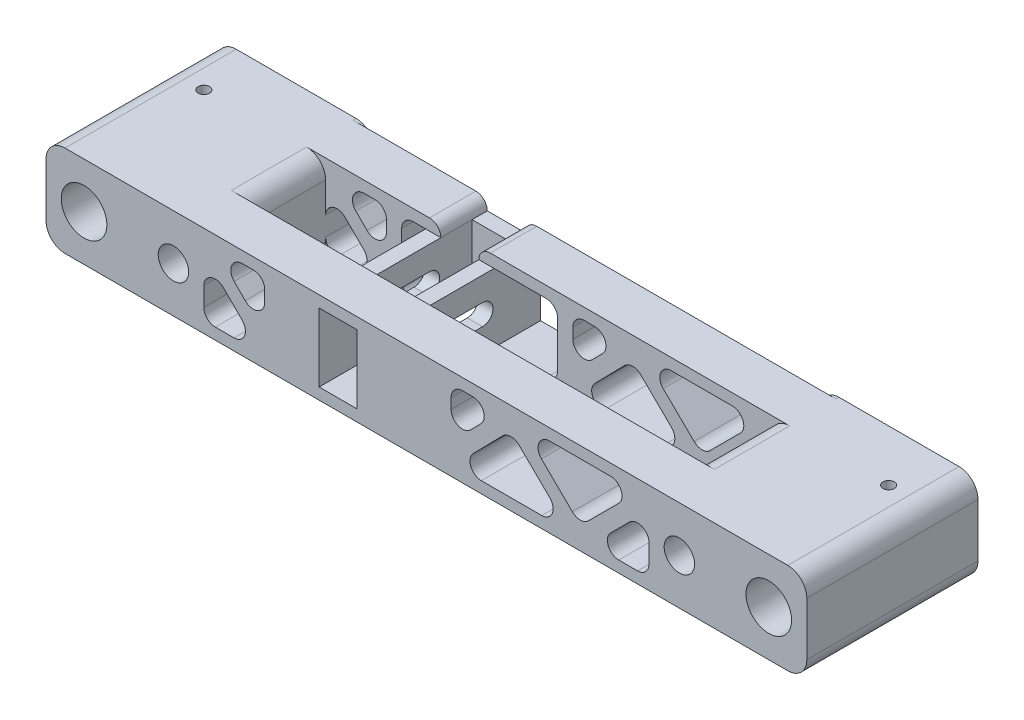
from build123d import *

# Parameters (mm, degrees)
SKETCH1_W           = 100
SKETCH1_H           = 24
SKETCH1_R           = 6
SKETCH1_R_2         = 4
BOSS_EXTRUDE1_DEPTH = 40
SKETCH2_W           = 100
SKETCH2_H           = 24
BOSS_EXTRUDE2_DEPTH = 5
CUT_EXTRUDE1_REACH  = 112.345
SKETCH3_W           = 58.5
SKETCH3_H           = 32.8
SKETCH4_W           = 10
SKETCH4_H           = 18
CUT_EXTRUDE2_DEPTH  = 108.943689023
SKETCH5_W           = 4
SKETCH5_H           = 18
BOSS_EXTRUDE3_DEPTH = 28
SKETCH6_W           = 18
SKETCH6_H           = 18
BOSS_EXTRUDE4_DEPTH = 4
CUT_EXTRUDE3_START  = -18
CUT_EXTRUDE3_DEPTH  = 18
SKETCH8_W           = 76.7
SKETCH8_H           = 12.2
SKETCH8_W_2         = 30.3
BOSS_EXTRUDE5_DEPTH = 3
BOSS_EXTRUDE6_DEPTH = 12.2
FILLET1_R           = 5
FILLET2_R           = 3
CUT_EXTRUDE4_START  = -12.2
CUT_EXTRUDE4_DEPTH  = 12.2
SKETCH11_R          = 1.5
CUT_EXTRUDE5_DEPTH  = 111.344913793
CUT_EXTRUDE6_DEPTH  = 4


with BuildPart() as part:
    # Sketch1 → Boss-Extrude1 (new body)
    with BuildSketch(Plane.XY):
        with Locations((-50, 12)):
            Rectangle(SKETCH1_W, SKETCH1_H)
        with Locations((-90, 12)):
            Circle(SKETCH1_R, mode=Mode.SUBTRACT)
        with Locations((-66.5, 12)):
            Circle(SKETCH1_R_2, mode=Mode.SUBTRACT)
    boss_extrude1 = extrude(amount=BOSS_EXTRUDE1_DEPTH)

    # Sketch2 → Boss-Extrude2 (add)
    with BuildSketch(Plane(origin=(0, 0, 0), x_dir=(-1, 0, 0), z_dir=(0, 0, -1))):
        with Locations((50, 12)):
            Rectangle(SKETCH2_W, SKETCH2_H)
    boss_extrude2 = extrude(amount=BOSS_EXTRUDE2_DEPTH)

    # Sketch3 → Cut-Extrude1 (cut, up to next)
    with BuildSketch(Plane(origin=(0, 24, 0), x_dir=(1, 0, 0), z_dir=(0, 1, 0)), mode=Mode.PRIVATE) as cut_extrude1_sk1:
        with Locations((-29.25, -11.4)):
            Rectangle(SKETCH3_W, SKETCH3_H)
    cut_extrude1_tool1 = extrude(cut_extrude1_sk1.sketch, amount=-CUT_EXTRUDE1_REACH, mode=Mode.PRIVATE) & part.part
    cut_extrude1 = cut_extrude1_tool1.solids().sort_by_distance((-29.25, 24, 11.4))[0]
    add(cut_extrude1, mode=Mode.SUBTRACT)

    # Mirror2: Boss-Extrude1, Boss-Extrude2, Cut-Extrude1 across Right Plane
    add(boss_extrude1.mirror(Plane(origin=(0, 0, 0), x_dir=(0, 0, -1), z_dir=(1, 0, 0))))
    add(boss_extrude2.mirror(Plane(origin=(0, 0, 0), x_dir=(0, 0, -1), z_dir=(1, 0, 0))))
    add(cut_extrude1.mirror(Plane(origin=(0, 0, 0), x_dir=(0, 0, -1), z_dir=(1, 0, 0))), mode=Mode.SUBTRACT)

    # Sketch4 → Cut-Extrude2 (cut, through all)
    with BuildSketch(Plane(origin=(0, 0, 27.8), x_dir=(-1, 0, 0), z_dir=(0, 0, -1))):
        with Locations((23.2, 12)):
            Rectangle(SKETCH4_W, SKETCH4_H)
    extrude(amount=-CUT_EXTRUDE2_DEPTH, mode=Mode.SUBTRACT)

    # Sketch5 → Boss-Extrude3 (add)
    with BuildSketch(Plane(origin=(0, 0, 27.8), x_dir=(-1, 0, 0), z_dir=(0, 0, -1))):
        with Locations((30.2, 12)):
            Rectangle(SKETCH5_W, SKETCH5_H)
        with Locations((16.2, 12)):
            Rectangle(SKETCH5_W, SKETCH5_H)
    extrude(amount=BOSS_EXTRUDE3_DEPTH)

    # Sketch6 → Boss-Extrude4 (add)
    with BuildSketch(Plane(origin=(0, 0, -0.2), x_dir=(-1, 0, 0), z_dir=(0, 0, -1))):
        with Locations((23.2, 12)):
            Rectangle(SKETCH6_W, SKETCH6_H)
    extrude(amount=BOSS_EXTRUDE4_DEPTH)

    # Sketch7 → Cut-Extrude3 (cut)
    with BuildSketch(Plane(origin=(-14.2, 0, 0), x_dir=(0, 0, -1), z_dir=(1, 0, 0)).offset(CUT_EXTRUDE3_START)):
        with BuildLine():
            Line((-20.05, 14.75), (-11.05, 14.75))
            ThreePointArc((-11.05, 14.75), (-8.3, 12), (-11.05, 9.25))
            Line((-11.05, 9.25), (-20.05, 9.25))
            ThreePointArc((-20.05, 9.25), (-22.8, 12), (-20.05, 14.75))
        make_face()
    extrude(amount=CUT_EXTRUDE3_DEPTH, mode=Mode.SUBTRACT)

    # Sketch8 → Boss-Extrude5 (add)
    with BuildSketch(Plane(origin=(0, 21, 0), x_dir=(1, 0, 0), z_dir=(0, 1, 0))):
        with Locations((20.15, -1.9)):
            Rectangle(SKETCH8_W, SKETCH8_H)
        with Locations((-43.35, -1.9)):
            Rectangle(SKETCH8_W_2, SKETCH8_H)
    boss_extrude5 = extrude(amount=BOSS_EXTRUDE5_DEPTH)

    # Mirror4: Boss-Extrude5 across plane
    add(boss_extrude5.mirror(Plane.ZX.offset(12)))

    # Sketch9 → Boss-Extrude6 (add)
    with BuildSketch(Plane(origin=(0, 0, -4.2), x_dir=(-1, 0, 0), z_dir=(0, 0, -1))):
        Polygon((-58.5, 18.171572875), (-43.328427125, 3), (-37.643941895, 3), (-22.177232561, 18.171703978), (-7.294907133, 3), (-2.493324251, 3), (-2.493324251, 21), (-6.493324251, 21), (-6.493324251, 7.894946994), (-19.348417117, 21), (-25.006058105, 21), (-40.486448643, 5.814875767), (-55.671572875, 21), (-58.5, 21), align=None)
        Polygon((55.671572875, 21), (42.5, 7.828427125), (42.5, 21), (38.5, 21), (38.5, 3), (43.328427125, 3), (58.5, 18.171572875), (58.5, 21), align=None)
    extrude(amount=-BOSS_EXTRUDE6_DEPTH)

    # Fillet1
    # the kernel refuses this fillet: 5 mm, written as the material it adds along each edge
    # the kernel refuses this fillet: 5 mm, written as the material it takes off along each edge
    with BuildSketch(Plane(origin=(58.5, 24, -4.5), x_dir=(1, 0, 0), z_dir=(0, 0, 1))) as fillet1_2_piece_1_section:
        with BuildLine():
            CenterArc((FILLET1_R, -FILLET1_R), FILLET1_R, 90, 90)
            Line((0, -FILLET1_R), (0, 0))
            Line((0, 0), (FILLET1_R, 0))
        make_face()
    fillet1_2_piece_1 = extrude(amount=44.8, mode=Mode.PRIVATE)
    fillet1_2_piece_1 = split(fillet1_2_piece_1, bisect_by=Plane(origin=(59.616839695, 22.883160305, -4.2), z_dir=(0, 0, -1)), keep=Keep.TOP, mode=Mode.PRIVATE)
    add(fillet1_2_piece_1, mode=Mode.SUBTRACT)
    with BuildSketch(Plane(origin=(58.5, 24, 8), x_dir=(1, 0, 0), z_dir=(0, 0, 1)), Plane(origin=(-58.5, 0, 8), x_dir=(-1, 0, 0), z_dir=(0, 0, 1))) as fillet1_2_piece_2:
        with BuildLine():
            CenterArc((FILLET1_R, -FILLET1_R), FILLET1_R, 90, 90)
            Line((0, -FILLET1_R), (0, 0))
            Line((0, 0), (FILLET1_R, 0))
        make_face()
    extrude(amount=19.8, mode=Mode.SUBTRACT)
    with BuildSketch(Plane(origin=(-58.5, 24, -4.5), x_dir=(-1, 0, 0), z_dir=(0, 0, 1))) as fillet1_2_piece_3_section:
        with BuildLine():
            CenterArc((FILLET1_R, FILLET1_R), FILLET1_R, 180, 90)
            Line((0, FILLET1_R), (0, 0))
            Line((0, 0), (FILLET1_R, 0))
        make_face()
    fillet1_2_piece_3 = extrude(amount=44.8, mode=Mode.PRIVATE)
    fillet1_2_piece_3 = split(fillet1_2_piece_3, bisect_by=Plane(origin=(-59.616839695, 22.883160305, -4.2), z_dir=(0, 0, -1)), keep=Keep.TOP, mode=Mode.PRIVATE)
    add(fillet1_2_piece_3, mode=Mode.SUBTRACT)
    with BuildSketch(Plane(origin=(-58.5, 24, 8), x_dir=(-1, 0, 0), z_dir=(0, 0, 1)), Plane(origin=(58.5, 0, 8), x_dir=(1, 0, 0), z_dir=(0, 0, 1))) as fillet1_2_piece_4:
        with BuildLine():
            CenterArc((FILLET1_R, FILLET1_R), FILLET1_R, 180, 90)
            Line((0, FILLET1_R), (0, 0))
            Line((0, 0), (FILLET1_R, 0))
        make_face()
    extrude(amount=19.8, mode=Mode.SUBTRACT)
    with BuildSketch(Plane(origin=(58.5, 0, -17.5), x_dir=(1, 0, 0), z_dir=(0, 0, 1)), Plane(origin=(-58.5, 24, -17.5), x_dir=(-1, 0, 0), z_dir=(0, 0, 1))) as fillet1_2_piece_5:
        with BuildLine():
            CenterArc((FILLET1_R, FILLET1_R), FILLET1_R, 180, 90)
            Line((0, FILLET1_R), (0, 0))
            Line((0, 0), (FILLET1_R, 0))
        make_face()
    extrude(amount=13.3, mode=Mode.SUBTRACT)
    with BuildSketch(Plane(origin=(58.5, 0, -17.5), x_dir=(1, 0, 0), z_dir=(0, 0, 1))) as fillet1_2_piece_6_section:
        with BuildLine():
            CenterArc((FILLET1_R, FILLET1_R), FILLET1_R, 180, 90)
            Line((0, FILLET1_R), (0, 0))
            Line((0, 0), (FILLET1_R, 0))
        make_face()
    fillet1_2_piece_6 = extrude(amount=25.8, mode=Mode.PRIVATE)
    fillet1_2_piece_6 = split(fillet1_2_piece_6, bisect_by=Plane(origin=(58.624277222, 3, 1.9), z_dir=(0, 1, 0)), keep=Keep.TOP, mode=Mode.PRIVATE)
    add(fillet1_2_piece_6, mode=Mode.SUBTRACT)
    with BuildSketch(Plane(origin=(58.5, 0, -17.5), x_dir=(1, 0, 0), z_dir=(0, 0, 1))) as fillet1_2_piece_7_section:
        with BuildLine():
            CenterArc((FILLET1_R, FILLET1_R), FILLET1_R, 180, 90)
            Line((0, FILLET1_R), (0, 0))
            Line((0, 0), (FILLET1_R, 0))
        make_face()
    fillet1_2_piece_7 = extrude(amount=25.8, mode=Mode.PRIVATE)
    fillet1_2_piece_7 = split(fillet1_2_piece_7, bisect_by=Plane(origin=(59.670149221, 0.989071886, 8), z_dir=(0, 0, 1)), keep=Keep.TOP, mode=Mode.PRIVATE)
    add(fillet1_2_piece_7, mode=Mode.SUBTRACT)
    with BuildSketch(Plane(origin=(-58.5, 0, -17.5), x_dir=(-1, 0, 0), z_dir=(0, 0, 1)), Plane(origin=(58.5, 24, -17.5), x_dir=(1, 0, 0), z_dir=(0, 0, 1))) as fillet1_2_piece_8:
        with BuildLine():
            CenterArc((FILLET1_R, -FILLET1_R), FILLET1_R, 90, 90)
            Line((0, -FILLET1_R), (0, 0))
            Line((0, 0), (FILLET1_R, 0))
        make_face()
    extrude(amount=13.3, mode=Mode.SUBTRACT)
    with BuildSketch(Plane(origin=(-58.5, 0, -17.5), x_dir=(-1, 0, 0), z_dir=(0, 0, 1))) as fillet1_2_piece_9_section:
        with BuildLine():
            CenterArc((FILLET1_R, -FILLET1_R), FILLET1_R, 90, 90)
            Line((0, -FILLET1_R), (0, 0))
            Line((0, 0), (FILLET1_R, 0))
        make_face()
    fillet1_2_piece_9 = extrude(amount=25.8, mode=Mode.PRIVATE)
    fillet1_2_piece_9 = split(fillet1_2_piece_9, bisect_by=Plane(origin=(-58.624277222, 3, 1.9), z_dir=(0, 1, 0)), keep=Keep.TOP, mode=Mode.PRIVATE)
    add(fillet1_2_piece_9, mode=Mode.SUBTRACT)
    with BuildSketch(Plane(origin=(-58.5, 0, -17.5), x_dir=(-1, 0, 0), z_dir=(0, 0, 1))) as fillet1_2_piece_10_section:
        with BuildLine():
            CenterArc((FILLET1_R, -FILLET1_R), FILLET1_R, 90, 90)
            Line((0, -FILLET1_R), (0, 0))
            Line((0, 0), (FILLET1_R, 0))
        make_face()
    fillet1_2_piece_10 = extrude(amount=25.8, mode=Mode.PRIVATE)
    fillet1_2_piece_10 = split(fillet1_2_piece_10, bisect_by=Plane(origin=(-59.670149221, 0.989071886, 8), z_dir=(0, 0, 1)), keep=Keep.TOP, mode=Mode.PRIVATE)
    add(fillet1_2_piece_10, mode=Mode.SUBTRACT)
    with BuildSketch(Plane(origin=(-58.5, 24, -17.5), x_dir=(-1, 0, 0), z_dir=(0, 0, 1))) as fillet1_2_piece_11_section:
        with BuildLine():
            CenterArc((FILLET1_R, FILLET1_R), FILLET1_R, 180, 90)
            Line((0, FILLET1_R), (0, 0))
            Line((0, 0), (FILLET1_R, 0))
        make_face()
    fillet1_2_piece_11 = extrude(amount=25.8, mode=Mode.PRIVATE)
    fillet1_2_piece_11 = split(fillet1_2_piece_11, bisect_by=Plane(origin=(-59.616839695, 22.883160305, 8), z_dir=(0, 0, 1)), keep=Keep.TOP, mode=Mode.PRIVATE)
    add(fillet1_2_piece_11, mode=Mode.SUBTRACT)
    with BuildSketch(Plane(origin=(-58.5, 0, -4.5), x_dir=(-1, 0, 0), z_dir=(0, 0, 1))) as fillet1_2_piece_12_section:
        with BuildLine():
            CenterArc((FILLET1_R, -FILLET1_R), FILLET1_R, 90, 90)
            Line((0, -FILLET1_R), (0, 0))
            Line((0, 0), (FILLET1_R, 0))
        make_face()
    fillet1_2_piece_12 = extrude(amount=44.8, mode=Mode.PRIVATE)
    fillet1_2_piece_12 = split(fillet1_2_piece_12, bisect_by=Plane(origin=(-59.670149221, 0.989071886, -4.2), z_dir=(0, 0, -1)), keep=Keep.TOP, mode=Mode.PRIVATE)
    add(fillet1_2_piece_12, mode=Mode.SUBTRACT)
    with BuildSketch(Plane(origin=(-58.5, 0, -4.5), x_dir=(-1, 0, 0), z_dir=(0, 0, 1))) as fillet1_2_piece_13_section:
        with BuildLine():
            CenterArc((FILLET1_R, -FILLET1_R), FILLET1_R, 90, 90)
            Line((0, -FILLET1_R), (0, 0))
            Line((0, 0), (FILLET1_R, 0))
        make_face()
    fillet1_2_piece_13 = extrude(amount=32.3, mode=Mode.PRIVATE)
    fillet1_2_piece_13 = split(fillet1_2_piece_13, bisect_by=Plane(origin=(-58.624277222, 3, 1.9), z_dir=(0, 1, 0)), keep=Keep.TOP, mode=Mode.PRIVATE)
    add(fillet1_2_piece_13, mode=Mode.SUBTRACT)
    with BuildSketch(Plane(origin=(100, 0, -17.5), x_dir=(-1, 0, 0), z_dir=(0, 0, 1)), Plane(origin=(-100, 0, 52.5), x_dir=(1, 0, 0), z_dir=(0, 0, -1))) as fillet1_2_piece_14:
        with BuildLine():
            CenterArc((FILLET1_R, -FILLET1_R), FILLET1_R, 90, 90)
            Line((0, -FILLET1_R), (0, 0))
            Line((0, 0), (FILLET1_R, 0))
        make_face()
    extrude(amount=70, mode=Mode.SUBTRACT)
    with BuildSketch(Plane(origin=(100, 24, -17.5), x_dir=(-1, 0, 0), z_dir=(0, 0, 1)), Plane(origin=(-100, 24, 52.5), x_dir=(1, 0, 0), z_dir=(0, 0, -1))) as fillet1_2_piece_15:
        with BuildLine():
            CenterArc((FILLET1_R, FILLET1_R), FILLET1_R, 180, 90)
            Line((0, FILLET1_R), (0, 0))
            Line((0, 0), (FILLET1_R, 0))
        make_face()
    extrude(amount=70, mode=Mode.SUBTRACT)
    with BuildSketch(Plane(origin=(58.5, 0, -4.5), x_dir=(1, 0, 0), z_dir=(0, 0, 1))) as fillet1_2_piece_16_section:
        with BuildLine():
            CenterArc((FILLET1_R, FILLET1_R), FILLET1_R, 180, 90)
            Line((0, FILLET1_R), (0, 0))
            Line((0, 0), (FILLET1_R, 0))
        make_face()
    fillet1_2_piece_16 = extrude(amount=44.8, mode=Mode.PRIVATE)
    fillet1_2_piece_16 = split(fillet1_2_piece_16, bisect_by=Plane(origin=(59.670149221, 0.989071886, -4.2), z_dir=(0, 0, -1)), keep=Keep.TOP, mode=Mode.PRIVATE)
    add(fillet1_2_piece_16, mode=Mode.SUBTRACT)
    with BuildSketch(Plane(origin=(58.5, 0, -4.5), x_dir=(1, 0, 0), z_dir=(0, 0, 1))) as fillet1_2_piece_17_section:
        with BuildLine():
            CenterArc((FILLET1_R, FILLET1_R), FILLET1_R, 180, 90)
            Line((0, FILLET1_R), (0, 0))
            Line((0, 0), (FILLET1_R, 0))
        make_face()
    fillet1_2_piece_17 = extrude(amount=32.3, mode=Mode.PRIVATE)
    fillet1_2_piece_17 = split(fillet1_2_piece_17, bisect_by=Plane(origin=(58.624277222, 3, 1.9), z_dir=(0, 1, 0)), keep=Keep.TOP, mode=Mode.PRIVATE)
    add(fillet1_2_piece_17, mode=Mode.SUBTRACT)
    with BuildSketch(Plane(origin=(58.5, 24, -17.5), x_dir=(1, 0, 0), z_dir=(0, 0, 1))) as fillet1_2_piece_18_section:
        with BuildLine():
            CenterArc((FILLET1_R, -FILLET1_R), FILLET1_R, 90, 90)
            Line((0, -FILLET1_R), (0, 0))
            Line((0, 0), (FILLET1_R, 0))
        make_face()
    fillet1_2_piece_18 = extrude(amount=25.8, mode=Mode.PRIVATE)
    fillet1_2_piece_18 = split(fillet1_2_piece_18, bisect_by=Plane(origin=(59.616839695, 22.883160305, 8), z_dir=(0, 0, 1)), keep=Keep.TOP, mode=Mode.PRIVATE)
    add(fillet1_2_piece_18, mode=Mode.SUBTRACT)

    # Fillet2
    # the kernel refuses this fillet: 3 mm, written as the material it adds along each edge
    with BuildSketch(Plane(origin=(-32.2, 3, 27.8), x_dir=(0, -1, 0), z_dir=(1, 0, 0)), Plane(origin=(-28.2, 21, 27.8), x_dir=(0, 1, 0), z_dir=(-1, 0, 0)), Plane(origin=(-18.2, 21, 27.8), x_dir=(0, 0, -1), z_dir=(1, 0, 0)), Plane(origin=(-14.2, 3, 27.8), x_dir=(0, 0, -1), z_dir=(-1, 0, 0))) as fillet2_piece_1:
        with BuildLine():
            CenterArc((FILLET2_R, FILLET2_R), FILLET2_R, 180, 90)
            Line((0, FILLET2_R), (0, 0))
            Line((0, 0), (FILLET2_R, 0))
        make_face()
    extrude(amount=4)
    with BuildSketch(Plane(origin=(55.671572875, 21, -4.2), x_dir=(-1, 0, 0), z_dir=(0, 0, 1)), Plane(origin=(-58.5, 18.171572875, -4.2), x_dir=(0, -1, 0), z_dir=(0, 0, 1)), Plane(origin=(-43.328427125, 3, -4.2), x_dir=(-0.7071067811865437, 0.7071067811865515, 0), z_dir=(0, 0, 1)), Plane(origin=(-55.671572875, 21, -4.2), x_dir=(0.7071067811865441, -0.7071067811865509, 0), z_dir=(0, 0, 1))) as fillet2_piece_2:
        with BuildLine():
            CenterArc((FILLET2_R * 2.41421356237, FILLET2_R), FILLET2_R, 135, 135)
            Line((FILLET2_R * 1.70710678119, FILLET2_R * 1.70710678119), (0, 0))
            Line((0, 0), (FILLET2_R * 2.41421356237, 0))
        make_face()
    extrude(amount=12.2)
    with BuildSketch(Plane(origin=(40.486448643, 5.814875767, -4.2), x_dir=(0.7071067811865565, 0.7071067811865386, 0), z_dir=(0, 0, 1))) as fillet2_piece_3:
        with BuildLine():
            CenterArc((FILLET2_R * 0.990417743269, FILLET2_R), FILLET2_R, 180.55166171, 89.44833829)
            Line((-FILLET2_R * 0.00953590488174, FILLET2_R * 0.990371835575), (0, 0))
            Line((0, 0), (FILLET2_R * 0.990417743269, 0))
        make_face()
    extrude(amount=12.2)
    with BuildSketch(Plane(origin=(25.006058105, 21, -4.2), x_dir=(1, 0, 0), z_dir=(0, 0, 1))) as fillet2_piece_4:
        with BuildLine():
            CenterArc((FILLET2_R * 2.44747349713, -FILLET2_R), FILLET2_R, 90, 135.55166171)
            Line((FILLET2_R * 1.747207632, -FILLET2_R * 1.71388214583), (0, 0))
            Line((0, 0), (FILLET2_R * 2.44747349713, 0))
        make_face()
    extrude(amount=12.2)
    with BuildSketch(Plane(origin=(19.348417117, 21, -4.2), x_dir=(-1, 0, 0), z_dir=(0, 0, 1))) as fillet2_piece_5:
        with BuildLine():
            CenterArc((FILLET2_R * 2.38171787184, FILLET2_R), FILLET2_R, 135.55166171, 134.44833829)
            Line((FILLET2_R * 1.66783572601, FILLET2_R * 1.70026586512), (0, 0))
            Line((0, 0), (FILLET2_R * 2.38171787184, 0))
        make_face()
    extrude(amount=12.2)
    with BuildSketch(Plane(origin=(6.493324251, 7.894946994, -4.2), x_dir=(0.7002658651241891, 0.7138821458349208, 0), z_dir=(0, 0, 1)), Plane(origin=(37.643941895, 3, -4.2), x_dir=(-0.713882145834921, 0.7002658651241889, 0), z_dir=(0, 0, 1))) as fillet2_piece_6:
        with BuildLine():
            CenterArc((FILLET2_R * 2.44747349713, FILLET2_R), FILLET2_R, 134.44833829, 135.55166171)
            Line((FILLET2_R * 1.747207632, FILLET2_R * 1.71388214583), (0, 0))
            Line((0, 0), (FILLET2_R * 2.44747349713, 0))
        make_face()
    extrude(amount=12.2)
    with BuildSketch(Plane(origin=(6.493324251, 21, -4.2), x_dir=(1, 0, 0), z_dir=(0, 0, 1)), Plane(origin=(2.493324251, 21, -4.2), x_dir=(0, -1, 0), z_dir=(0, 0, 1)), Plane(origin=(2.493324251, 3, -4.2), x_dir=(-1, 0, 0), z_dir=(0, 0, 1))) as fillet2_piece_7:
        with BuildLine():
            CenterArc((FILLET2_R, -FILLET2_R), FILLET2_R, 90, 90)
            Line((0, -FILLET2_R), (0, 0))
            Line((0, 0), (FILLET2_R, 0))
        make_face()
    extrude(amount=12.2)
    with BuildSketch(Plane(origin=(7.294907133, 3, -4.2), x_dir=(0.7002658651241888, 0.713882145834921, 0), z_dir=(0, 0, 1))) as fillet2_piece_8:
        with BuildLine():
            CenterArc((FILLET2_R * 2.38171787184, -FILLET2_R), FILLET2_R, 90, 134.44833829)
            Line((FILLET2_R * 1.66783572601, -FILLET2_R * 1.70026586512), (0, 0))
            Line((0, 0), (FILLET2_R * 2.38171787184, 0))
        make_face()
    extrude(amount=12.2)
    with BuildSketch(Plane(origin=(22.177232561, 18.171703978, -4.2), x_dir=(-0.700265865124189, -0.7138821458349208, 0), z_dir=(0, 0, 1)), Plane(origin=(-38.5, 3, -4.2), x_dir=(1, 0, 0), z_dir=(0, 0, 1)), Plane(origin=(-38.5, 21, -4.2), x_dir=(0, -1, 0), z_dir=(0, 0, 1)), Plane(origin=(-42.5, 21, -4.2), x_dir=(-1, 0, 0), z_dir=(0, 0, 1))) as fillet2_piece_9:
        with BuildLine():
            CenterArc((FILLET2_R, FILLET2_R), FILLET2_R, 180, 90)
            Line((0, FILLET2_R), (0, 0))
            Line((0, 0), (FILLET2_R, 0))
        make_face()
    extrude(amount=12.2)
    with BuildSketch(Plane(origin=(43.328427125, 3, -4.2), x_dir=(0.707106781186556, 0.7071067811865389, 0), z_dir=(0, 0, 1)), Plane(origin=(58.5, 18.171572875, -4.2), x_dir=(0, -1, 0), z_dir=(0, 0, 1)), Plane(origin=(-42.5, 7.828427125, -4.2), x_dir=(-0.707106781186544, 0.707106781186551, 0), z_dir=(0, 0, 1))) as fillet2_piece_10:
        with BuildLine():
            CenterArc((FILLET2_R * 2.41421356237, -FILLET2_R), FILLET2_R, 90, 135)
            Line((FILLET2_R * 1.70710678119, -FILLET2_R * 1.70710678119), (0, 0))
            Line((0, 0), (FILLET2_R * 2.41421356237, 0))
        make_face()
    extrude(amount=12.2)
    with BuildSketch(Plane(origin=(58.917424305, 3, 8), x_dir=(-1, 0, 0), z_dir=(0, 0, -1))) as fillet2_piece_11:
        with BuildLine():
            CenterArc((3.417424305, 3), FILLET2_R, 180, 90)
            Line((0.417424305, 3), (0.117424305, 3))
            ThreePointArc((0.117424305, 3), (0.117424305, 2), (-0.274954542, 0.12))
            Line((-0.274954542, 0.12), (0, -0.3))
            Line((0, -0.3), (3.417424305, -0.3))
            Line((3.417424305, -0.3), (3.417424305, 0))
        make_face()
    extrude(amount=12.2)
    with BuildSketch(Plane(origin=(-58.917424305, 3, 8), x_dir=(1, 0, 0), z_dir=(0, 0, -1))) as fillet2_piece_12:
        with BuildLine():
            CenterArc((3.417424305, -3), FILLET2_R, 90, 90)
            Line((0.417424305, -3), (0.117424305, -3))
            ThreePointArc((0.117424305, -3), (0.117424305, -2), (-0.274954542, -0.12))
            Line((-0.274954542, -0.12), (0, 0.3))
            Line((0, 0.3), (3.417424305, 0.3))
            Line((3.417424305, 0.3), (3.417424305, 0))
        make_face()
    extrude(amount=12.2)
    # the kernel refuses this fillet: 3 mm, written as the material it takes off along each edge
    with BuildSketch(Plane(origin=(-18.2, 24, 15.5), x_dir=(1, 0, 0), z_dir=(0, 0, -1)), Plane(origin=(-28.2, 0, 15.5), x_dir=(-1, 0, 0), z_dir=(0, 0, -1))) as fillet2_2_piece_1:
        with BuildLine():
            CenterArc((FILLET2_R, FILLET2_R), FILLET2_R, 180, 90)
            Line((0, FILLET2_R), (0, 0))
            Line((0, 0), (FILLET2_R, 0))
        make_face()
    extrude(amount=27.2, mode=Mode.SUBTRACT)
    with BuildSketch(Plane(origin=(-28.2, 24, 15.5), x_dir=(-1, 0, 0), z_dir=(0, 0, -1)), Plane(origin=(-18.2, 0, 15.5), x_dir=(1, 0, 0), z_dir=(0, 0, -1))) as fillet2_2_piece_2:
        with BuildLine():
            CenterArc((FILLET2_R, -FILLET2_R), FILLET2_R, 90, 90)
            Line((0, -FILLET2_R), (0, 0))
            Line((0, 0), (FILLET2_R, 0))
        make_face()
    extrude(amount=27.2, mode=Mode.SUBTRACT)

    # Sketch10 → Cut-Extrude4 (cut)
    with BuildSketch(Plane.XY.offset(40).offset(CUT_EXTRUDE4_START)):
        with BuildLine():
            Line((-55.5, 3), (-50.571067812, 3))
            ThreePointArc((-50.571067812, 3), (-47.799429214, 4.851949703), (-48.449747468, 8.121320344))
            Line((-48.449747468, 8.121320344), (-53.378679656, 13.050252532))
            ThreePointArc((-53.378679656, 13.050252532), (-56.648050297, 13.700570786), (-58.5, 10.928932188))
            Line((-58.5, 10.928932188), (-58.5, 6))
            ThreePointArc((-58.5, 6), (-57.621320344, 3.878679656), (-55.5, 3))
        make_face()
        with BuildLine():
            Line((-50.550252532, 15.878679656), (-47.621320344, 12.949747468))
            ThreePointArc((-47.621320344, 12.949747468), (-44.351949703, 12.299429214), (-42.5, 15.071067812))
            Line((-42.5, 15.071067812), (-42.5, 18))
            ThreePointArc((-42.5, 18), (-43.378679656, 20.121320344), (-45.5, 21))
            Line((-45.5, 21), (-48.428932188, 21))
            ThreePointArc((-48.428932188, 21), (-51.200570786, 19.148050297), (-50.550252532, 15.878679656))
        make_face()
        with BuildLine():
            Line((6.493324251, 18), (6.493324251, 15.237367486))
            ThreePointArc((6.493324251, 15.237367486), (8.358630308, 12.460234133), (11.634970688, 13.13656989))
            Line((11.634970688, 13.13656989), (14.344909939, 15.899202405))
            ThreePointArc((14.344909939, 15.899202405), (14.969343109, 19.161380044), (12.203263502, 21))
            Line((12.203263502, 21), (9.493324251, 21))
            ThreePointArc((9.493324251, 21), (7.372003907, 20.121320344), (6.493324251, 18))
        make_face()
        with BuildLine():
            Line((14.440060749, 3), (30.301521403, 3))
            ThreePointArc((30.301521403, 3), (33.078654756, 4.865306057), (32.402318999, 8.141646438))
            Line((32.402318999, 8.141646438), (24.318878999, 16.070906383))
            ThreePointArc((24.318878999, 16.070906383), (22.18919691, 16.92912089), (20.076434966, 16.030057541))
            Line((20.076434966, 16.030057541), (12.298414311, 8.100797595))
            ThreePointArc((12.298414311, 8.100797595), (11.673981142, 4.838619956), (14.440060749, 3))
        make_face()
        with BuildLine():
            Line((50.571067812, 3), (55.5, 3))
            ThreePointArc((55.5, 3), (57.621320344, 3.878679656), (58.5, 6))
            Line((58.5, 6), (58.5, 10.928932188))
            ThreePointArc((58.5, 10.928932188), (56.648050297, 13.700570786), (53.378679656, 13.050252532))
            Line((53.378679656, 13.050252532), (48.449747468, 8.121320344))
            ThreePointArc((48.449747468, 8.121320344), (47.799429214, 4.851949703), (50.571067812, 3))
        make_face()
        with BuildLine():
            Line((32.348478597, 21), (48.428932188, 21))
            ThreePointArc((48.428932188, 21), (51.200570786, 19.148050297), (50.550252532, 15.878679656))
            Line((50.550252532, 15.878679656), (42.58744195, 7.915869075))
            ThreePointArc((42.58744195, 7.915869075), (40.48056402, 7.037224182), (38.365324011, 7.895542981))
            Line((38.365324011, 7.895542981), (30.247681001, 15.858353562))
            ThreePointArc((30.247681001, 15.858353562), (29.571345244, 19.134693943), (32.348478597, 21))
        make_face()
    extrude(amount=CUT_EXTRUDE4_DEPTH, mode=Mode.SUBTRACT)

    # Sketch11 → Cut-Extrude5 (cut, through all)
    with BuildSketch(Plane(origin=(0, 24, 0), x_dir=(1, 0, 0), z_dir=(0, 1, 0))):
        with Locations(Location((90, -8.5, 0), (0, 0, 180))):
            Circle(SKETCH11_R)
        with Locations(Location((-90, -8.5, 0), (0, 0, 180))):
            Circle(SKETCH11_R)
    extrude(amount=-CUT_EXTRUDE5_DEPTH, mode=Mode.SUBTRACT)

    # Sketch12 → Cut-Extrude6 (cut)
    with BuildSketch(Plane.XZ):
        Polygon((-87.25, 6.91228676), (-87.25, 10.08771324), (-90, 11.675426481), (-92.75, 10.08771324), (-92.75, 6.91228676), (-90, 5.324573519), align=None)
        Polygon((92.75, 10.08771324), (90, 11.675426481), (87.25, 10.08771324), (87.25, 6.91228676), (90, 5.324573519), (92.75, 6.91228676), align=None)
    extrude(amount=-CUT_EXTRUDE6_DEPTH, mode=Mode.SUBTRACT)


solid = part.part
